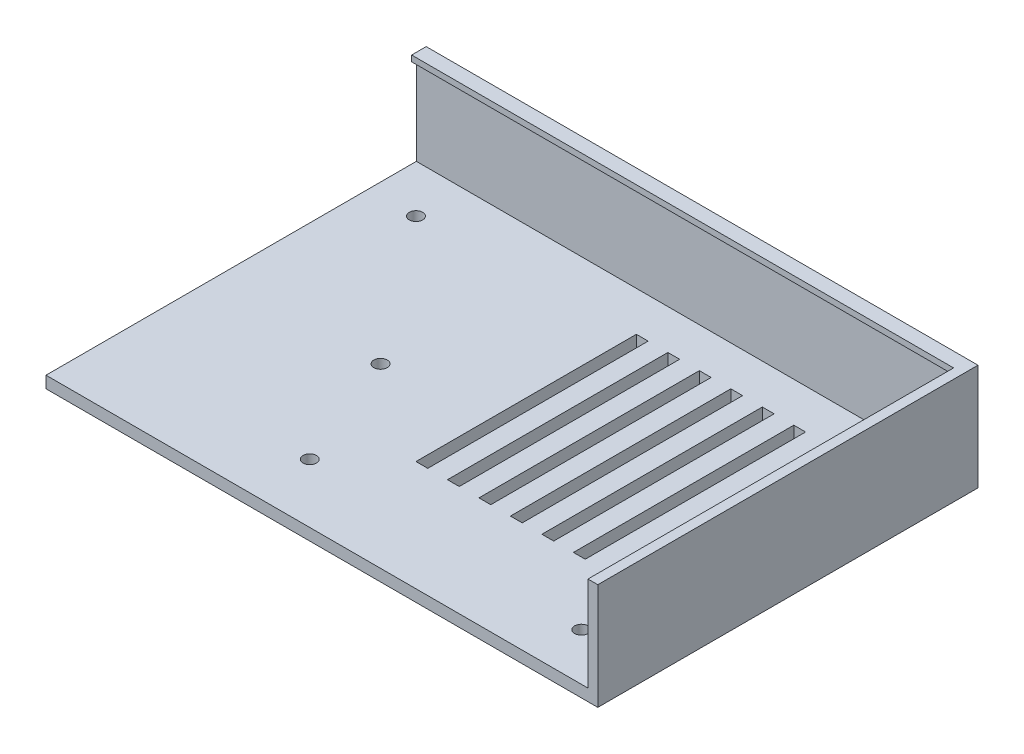
from build123d import *

# Parameters (mm, degrees)
SKETCH1_W                     = 280.4
SKETCH1_H                     = 193.2
SHELL_BLOCK_DEPTH             = 27
SKETCH2_W                     = 275.4
SKETCH2_H                     = 185.8
FRONT_OPENING_DEPTH           = 1.5
SKETCH3_W                     = 275.4
SKETCH3_H                     = 188.2
DISPLAY_POCKET_DEPTH          = 22.5
SKETCH4_W                     = 3
SKETCH4_H                     = 56
VENT_SLOTS_DEPTH              = 4
SKETCH5_W                     = 70
SKETCH5_H                     = 16
CABLE_EXIT_X_SHORT_SIDE_DEPTH = 141.2
SKETCH6_R                     = 1.7
BOLT_HOLES_DEPTH              = 4
KEEP_ONE_HALF_X_DEPTH         = 173.385034153
KEEP_ONE_HALF_X_DEPTH_BACK    = 173.385034153
SKETCH7_W                     = 200
SKETCH7_H                     = 400
KEEP_ONE_QUARTER_Z_DEPTH      = 173.385034153
KEEP_ONE_QUARTER_Z_DEPTH_BACK = 173.385034153
SKETCH8_W                     = 400
SKETCH8_H                     = 200


with BuildPart() as part:
    # Sketch1 → Shell Block (new body)
    with BuildSketch(Plane(origin=(0, 0, 0), x_dir=(1, 0, 0), z_dir=(0, 1, 0))):
        Rectangle(SKETCH1_W, SKETCH1_H)
    extrude(amount=SHELL_BLOCK_DEPTH)

    # Sketch2 → Front Opening (cut)
    with BuildSketch(Plane(origin=(0, 27, 0), x_dir=(1, 0, 0), z_dir=(0, 1, 0))):
        Rectangle(SKETCH2_W, SKETCH2_H)
    extrude(amount=-FRONT_OPENING_DEPTH, mode=Mode.SUBTRACT)

    # Sketch3 → Display Pocket (cut)
    with BuildSketch(Plane(origin=(0, 25.5, 0), x_dir=(1, 0, 0), z_dir=(0, 1, 0))):
        Rectangle(SKETCH3_W, SKETCH3_H)
    extrude(amount=-DISPLAY_POCKET_DEPTH, mode=Mode.SUBTRACT)

    # Sketch4 → Vent Slots (cut)
    with BuildSketch(Plane(origin=(0, 3, 0), x_dir=(1, 0, 0), z_dir=(0, 1, 0))):
        with Locations((67.5, 56)):
            Rectangle(SKETCH4_W, SKETCH4_H)
        with Locations((67.5, -56)):
            Rectangle(SKETCH4_W, SKETCH4_H)
        with Locations((75.5, 56)):
            Rectangle(SKETCH4_W, SKETCH4_H)
        with Locations((75.5, -56)):
            Rectangle(SKETCH4_W, SKETCH4_H)
        with Locations((83.5, 56)):
            Rectangle(SKETCH4_W, SKETCH4_H)
        with Locations((83.5, -56)):
            Rectangle(SKETCH4_W, SKETCH4_H)
        with Locations((91.5, 56)):
            Rectangle(SKETCH4_W, SKETCH4_H)
        with Locations((91.5, -56)):
            Rectangle(SKETCH4_W, SKETCH4_H)
        with Locations((99.5, 56)):
            Rectangle(SKETCH4_W, SKETCH4_H)
        with Locations((99.5, -56)):
            Rectangle(SKETCH4_W, SKETCH4_H)
        with Locations((107.5, 56)):
            Rectangle(SKETCH4_W, SKETCH4_H)
        with Locations((107.5, -56)):
            Rectangle(SKETCH4_W, SKETCH4_H)
        with Locations((115.5, 56)):
            Rectangle(SKETCH4_W, SKETCH4_H)
        with Locations((115.5, -56)):
            Rectangle(SKETCH4_W, SKETCH4_H)
        with Locations((123.5, 56)):
            Rectangle(SKETCH4_W, SKETCH4_H)
        with Locations((123.5, -56)):
            Rectangle(SKETCH4_W, SKETCH4_H)
    extrude(amount=-VENT_SLOTS_DEPTH, mode=Mode.SUBTRACT)

    # Sketch5 → Cable Exit (+X short side) (cut)
    with BuildSketch(Plane(origin=(0, 0, 0), x_dir=(0, 0, -1), z_dir=(1, 0, 0))):
        with Locations((0, 13)):
            Rectangle(SKETCH5_W, SKETCH5_H)
    extrude(amount=-CABLE_EXIT_X_SHORT_SIDE_DEPTH, mode=Mode.SUBTRACT)

    # Sketch6 → Bolt Holes (cut)
    with BuildSketch(Plane(origin=(0, 3, 0), x_dir=(1, 0, 0), z_dir=(0, 1, 0))):
        with Locations((-40, -45)):
            Circle(SKETCH6_R)
        with Locations((-40, 45)):
            Circle(SKETCH6_R)
        with Locations((40, -45)):
            Circle(SKETCH6_R)
        with Locations((40, 45)):
            Circle(SKETCH6_R)
        with Locations((-52, -15)):
            Circle(SKETCH6_R)
        with Locations((-52, 15)):
            Circle(SKETCH6_R)
        with Locations((52, -15)):
            Circle(SKETCH6_R)
        with Locations((52, 15)):
            Circle(SKETCH6_R)
        with Locations((-12, -82)):
            Circle(SKETCH6_R)
        with Locations((-12, 82)):
            Circle(SKETCH6_R)
        with Locations((12, -82)):
            Circle(SKETCH6_R)
        with Locations((12, 82)):
            Circle(SKETCH6_R)
        with Locations((-124, -12)):
            Circle(SKETCH6_R)
        with Locations((-124, 12)):
            Circle(SKETCH6_R)
        with Locations((124, -12)):
            Circle(SKETCH6_R)
        with Locations((124, 12)):
            Circle(SKETCH6_R)
    extrude(amount=-BOLT_HOLES_DEPTH, mode=Mode.SUBTRACT)

    # Sketch7 → Keep one half (X) (cut, two sides: drawn at the far end of the back side and taken through both)
    with BuildSketch(Plane(origin=(0, 0, 0), x_dir=(1, 0, 0), z_dir=(0, 1, 0)).offset(-KEEP_ONE_HALF_X_DEPTH_BACK)):
        with Locations((-100, 0)):
            Rectangle(SKETCH7_W, SKETCH7_H)
    extrude(amount=KEEP_ONE_HALF_X_DEPTH + KEEP_ONE_HALF_X_DEPTH_BACK, mode=Mode.SUBTRACT)

    # Sketch8 → Keep one quarter (Z) (cut, two sides: drawn at the far end of the back side and taken through both)
    with BuildSketch(Plane(origin=(0, 0, 0), x_dir=(1, 0, 0), z_dir=(0, 1, 0)).offset(-KEEP_ONE_QUARTER_Z_DEPTH_BACK)):
        with Locations((0, -100)):
            Rectangle(SKETCH8_W, SKETCH8_H)
    extrude(amount=KEEP_ONE_QUARTER_Z_DEPTH + KEEP_ONE_QUARTER_Z_DEPTH_BACK, mode=Mode.SUBTRACT)


solid = part.part
